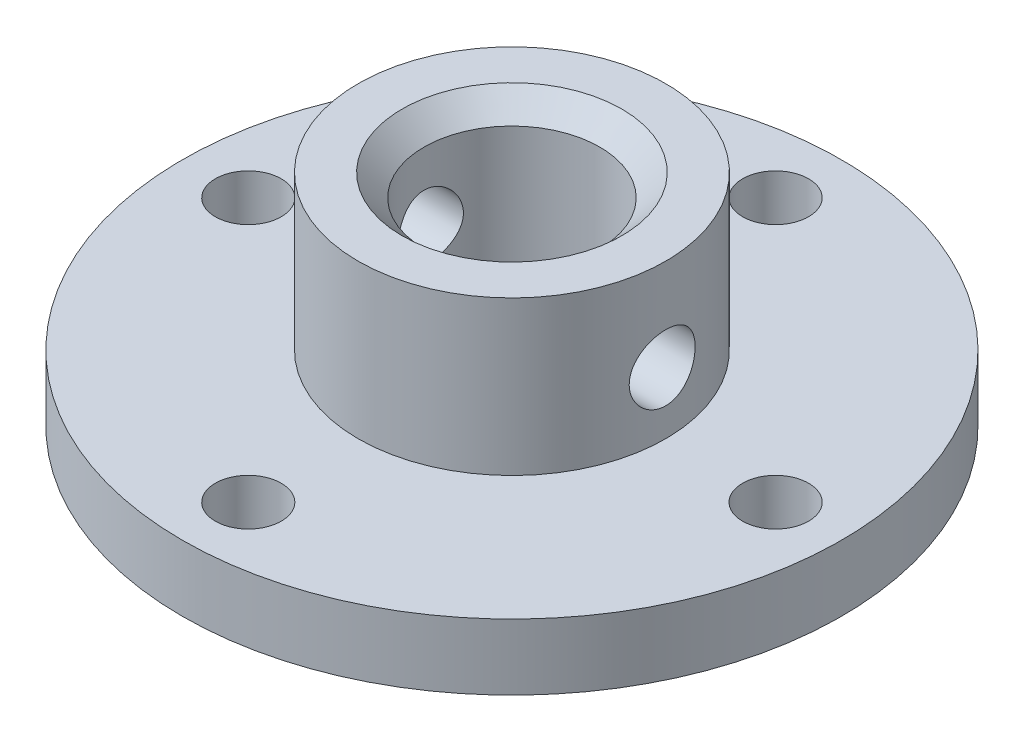
from build123d import *

# Parameters (mm, degrees)
SKETCH_1_R               = 15
SKETCH_1_R_2             = 4
EXTRUDE_1_DEPTH          = 3
SKETCH_2_R               = 7
SKETCH_2_R_2             = 4
EXTRUDE_2_DEPTH          = 7
CUT_EXTRUDE_1_DEPTH      = 13
CUT_EXTRUDE_1_DEPTH_BACK = 12
SKETCH_5_R               = 1.5
SKETCH_7_R               = 1.5
CUT_EXTRUDE_3_DEPTH      = 4
CHAMFER_1_SIZE           = 1


with BuildPart() as part:
    # 草图1 → 凸台-拉伸1 (new body)
    with BuildSketch(Plane(origin=(0, 0, 0), x_dir=(1, 0, 0), z_dir=(0, 1, 0))):
        Circle(SKETCH_1_R)
        Circle(SKETCH_1_R_2, mode=Mode.SUBTRACT)
    extrude(amount=EXTRUDE_1_DEPTH)

    # 草图2 → 凸台-拉伸2 (add)
    with BuildSketch(Plane(origin=(0, 3, 0), x_dir=(1, 0, 0), z_dir=(0, 1, 0))):
        Circle(SKETCH_2_R)
        Circle(SKETCH_2_R_2, mode=Mode.SUBTRACT)
    extrude(amount=EXTRUDE_2_DEPTH)

    # 草图5 → 切除-拉伸1 (cut, two sides: drawn at the far end of the back side and taken through both)
    with BuildSketch(Plane.ZY.offset(-CUT_EXTRUDE_1_DEPTH_BACK)):
        with Locations((0, 5.8)):
            Circle(SKETCH_5_R)
    extrude(amount=CUT_EXTRUDE_1_DEPTH + CUT_EXTRUDE_1_DEPTH_BACK, mode=Mode.SUBTRACT)

    # 草图7 → 切除-拉伸3 (cut)
    with BuildSketch(Plane(origin=(0, 3, 0), x_dir=(1, 0, 0), z_dir=(0, 1, 0))):
        with Locations((0, -12)):
            Circle(SKETCH_7_R)
        with Locations((-12, 0)):
            Circle(SKETCH_7_R)
        with Locations((0, 12)):
            Circle(SKETCH_7_R)
        with Locations((12, 0)):
            Circle(SKETCH_7_R)
    extrude(amount=-CUT_EXTRUDE_3_DEPTH, mode=Mode.SUBTRACT)

    # 倒角1
    chamfer_1_edges = [part.edges().sort_by_distance(p)[0] for p in [
        (-4, 10, 0),
    ]]
    chamfer(chamfer_1_edges, length=CHAMFER_1_SIZE)


solid = part.part
